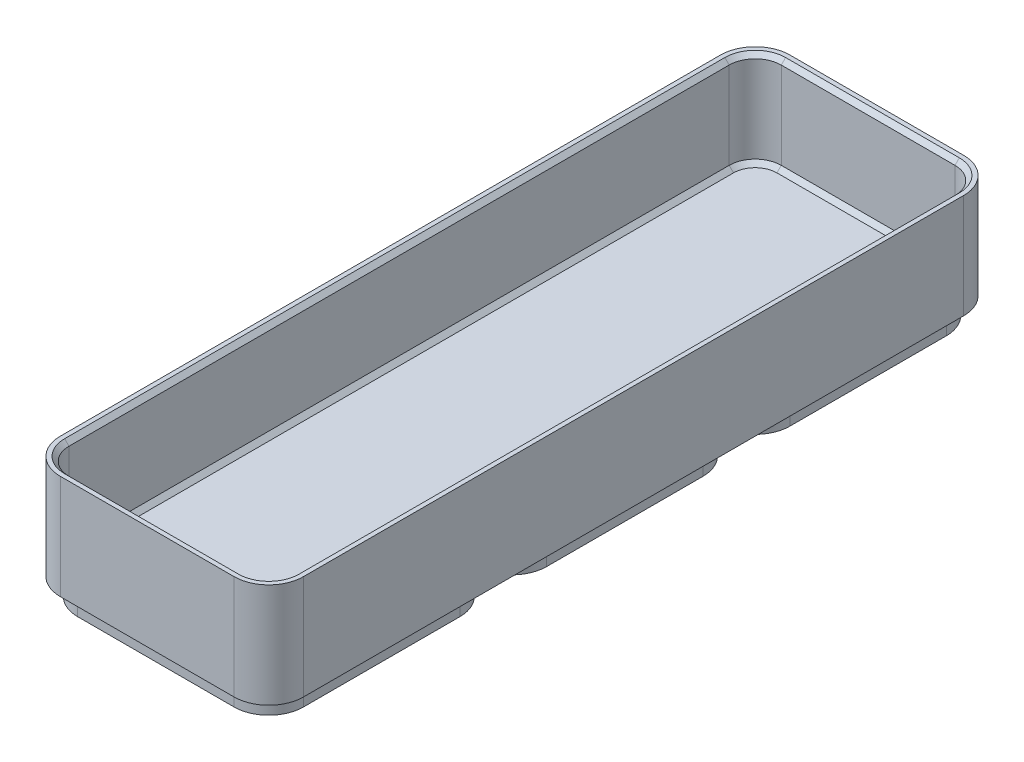
from build123d import *

# Parameters (mm, degrees)
BOSS_EXTRUDE4_DEPTH = 5
SKETCH7_R           = 3
CUT_EXTRUDE4_DEPTH  = 2
SKETCH8_W           = 70
SKETCH8_H           = 70
BOSS_EXTRUDE5_DEPTH = 30
MIRROR2_START       = 5
MIRROR2_OUTLINE_W   = 70
MIRROR2_OUTLINE_H   = 70
MIRROR2_DEPTH       = 30
MIRROR2_2_OUTLINE_R = 3
MIRROR2_2_DEPTH     = 5
MIRROR2_START_2     = 2
MIRROR2_3_OUTLINE_R = 3
MIRROR2_3_DEPTH     = 3
FILLET1_R           = 10
CUT_EXTRUDE5_DEPTH  = 30
BOSS_EXTRUDE6_DEPTH = 2.5
CHAMFER1_SIZE       = 1.25


# Read off the part's stored shape, not the designer's step: Mirror2
with BuildPart() as part:
    # Sketch5 → Boss-Extrude4 (new body)
    with BuildSketch(Plane(origin=(0, 0, 0), x_dir=(1, 0, 0), z_dir=(0, 1, 0))):
        with BuildLine():
            Line((-22.5, -32.5), (22.5, -32.5))
            ThreePointArc((22.5, -32.5), (29.571067812, -29.571067812), (32.5, -22.5))
            Line((32.5, -22.5), (32.5, 22.5))
            ThreePointArc((32.5, 22.5), (29.571067812, 29.571067812), (22.5, 32.5))
            Line((22.5, 32.5), (-22.5, 32.5))
            ThreePointArc((-22.5, 32.5), (-29.571067812, 29.571067812), (-32.5, 22.5))
            Line((-32.5, 22.5), (-32.5, -22.5))
            ThreePointArc((-32.5, -22.5), (-29.571067812, -29.571067812), (-22.5, -32.5))
        make_face()
    extrude(amount=BOSS_EXTRUDE4_DEPTH)

    # Sketch7 → Cut-Extrude4 (cut)
    with BuildSketch(Plane.XZ):
        with Locations(Location((-26.035533906, 26.035533906, 0), (0, 0, 270))):
            Circle(SKETCH7_R)
        with Locations(Location((26.036533906, 26.036533906, 0), (0, 0, 270))):
            Circle(SKETCH7_R)
        with Locations(Location((26.037533906, -26.035533906, 0), (0, 0, 270))):
            Circle(SKETCH7_R)
        with Locations(Location((-26.034533906, -26.036533906, 0), (0, 0, 270))):
            Circle(SKETCH7_R)
    extrude(amount=-CUT_EXTRUDE4_DEPTH, mode=Mode.SUBTRACT)

    # Sketch8 → Boss-Extrude5 (add)
    with BuildSketch(Plane(origin=(0, 5, 0), x_dir=(1, 0, 0), z_dir=(0, 1, 0))):
        Rectangle(SKETCH8_W, SKETCH8_H)
    extrude(amount=BOSS_EXTRUDE5_DEPTH)

    # Mirror2 outline → Mirror2 (add)
    with BuildSketch(Plane(origin=(0, 0, 0), x_dir=(1, 0, 0), z_dir=(0, 1, 0)).offset(MIRROR2_START)):
        with Locations((0, -70)):
            Rectangle(MIRROR2_OUTLINE_W, MIRROR2_OUTLINE_H)
        with Locations((0, 70)):
            Rectangle(MIRROR2_OUTLINE_W, MIRROR2_OUTLINE_H)
    extrude(amount=MIRROR2_DEPTH)

    # Mirror2 2 outline → Mirror2 2 (add)
    # profile 1 of 2: a face of its own
    with BuildSketch(Plane(origin=(0, 0, 0), x_dir=(1, 0, 0), z_dir=(0, 1, 0))):
        with BuildLine():
            Line((32.5, -92.5), (32.5, -47.5))
            ThreePointArc((32.5, -47.5), (29.571067812, -40.428932188), (22.5, -37.5))
            Line((22.5, -37.5), (-22.5, -37.5))
            ThreePointArc((-22.5, -37.5), (-29.571067812, -40.428932188), (-32.5, -47.5))
            Line((-32.5, -47.5), (-32.5, -92.5))
            ThreePointArc((-32.5, -92.5), (-29.571067812, -99.571067812), (-22.5, -102.5))
            Line((-22.5, -102.5), (22.5, -102.5))
            ThreePointArc((22.5, -102.5), (29.571067812, -99.571067812), (32.5, -92.5))
        make_face()
        with Locations((-26.034533906, -96.036533906)):
            Circle(MIRROR2_2_OUTLINE_R, mode=Mode.SUBTRACT)
        with Locations((-26.035533906, -43.964466094)):
            Circle(MIRROR2_2_OUTLINE_R, mode=Mode.SUBTRACT)
        with Locations((26.037533906, -96.035533906)):
            Circle(MIRROR2_2_OUTLINE_R, mode=Mode.SUBTRACT)
        with Locations((26.036533906, -43.963466094)):
            Circle(MIRROR2_2_OUTLINE_R, mode=Mode.SUBTRACT)
    # profile 2 of 2: a face of its own
    with BuildSketch(Plane(origin=(0, 0, 0), x_dir=(1, 0, 0), z_dir=(0, 1, 0))):
        with BuildLine():
            Line((32.5, 47.5), (32.5, 92.5))
            ThreePointArc((32.5, 92.5), (29.571067812, 99.571067812), (22.5, 102.5))
            Line((22.5, 102.5), (-22.5, 102.5))
            ThreePointArc((-22.5, 102.5), (-29.571067812, 99.571067812), (-32.5, 92.5))
            Line((-32.5, 92.5), (-32.5, 47.5))
            ThreePointArc((-32.5, 47.5), (-29.571067812, 40.428932188), (-22.5, 37.5))
            Line((-22.5, 37.5), (22.5, 37.5))
            ThreePointArc((22.5, 37.5), (29.571067812, 40.428932188), (32.5, 47.5))
        make_face()
        with Locations((-26.034533906, 43.963466094)):
            Circle(MIRROR2_2_OUTLINE_R, mode=Mode.SUBTRACT)
        with Locations((-26.035533906, 96.035533906)):
            Circle(MIRROR2_2_OUTLINE_R, mode=Mode.SUBTRACT)
        with Locations((26.037533906, 43.964466094)):
            Circle(MIRROR2_2_OUTLINE_R, mode=Mode.SUBTRACT)
        with Locations((26.036533906, 96.036533906)):
            Circle(MIRROR2_2_OUTLINE_R, mode=Mode.SUBTRACT)
    extrude(amount=MIRROR2_2_DEPTH)

    # Mirror2 3 outline → Mirror2 3 (add)
    with BuildSketch(Plane(origin=(0, 0, 0), x_dir=(1, 0, 0), z_dir=(0, 1, 0)).offset(MIRROR2_START_2)):
        with Locations((-26.035533906, -43.964466094)):
            Circle(MIRROR2_3_OUTLINE_R)
        with Locations((26.036533906, -43.963466094)):
            Circle(MIRROR2_3_OUTLINE_R)
        with Locations((26.037533906, -96.035533906)):
            Circle(MIRROR2_3_OUTLINE_R)
        with Locations((-26.034533906, -96.036533906)):
            Circle(MIRROR2_3_OUTLINE_R)
        with Locations((-26.035533906, 96.035533906)):
            Circle(MIRROR2_3_OUTLINE_R)
        with Locations((26.036533906, 96.036533906)):
            Circle(MIRROR2_3_OUTLINE_R)
        with Locations((26.037533906, 43.964466094)):
            Circle(MIRROR2_3_OUTLINE_R)
        with Locations((-26.034533906, 43.963466094)):
            Circle(MIRROR2_3_OUTLINE_R)
    extrude(amount=MIRROR2_3_DEPTH)

    # Fillet1
    fillet1_edges = [part.edges().sort_by_distance(p)[0] for p in [
        (35, 20, 105),
        (-35, 20, 105),
        (-35, 20, -105),
        (35, 20, -105),
    ]]
    fillet(fillet1_edges, radius=FILLET1_R)

    # Sketch9 → Cut-Extrude5 (cut)
    with BuildSketch(Plane(origin=(0, 35, 0), x_dir=(1, 0, 0), z_dir=(0, 1, 0))):
        with BuildLine():
            Line((-32.5, 95), (-32.5, -95))
            ThreePointArc((-32.5, -95), (-30.303300859, -100.303300859), (-25, -102.5))
            Line((-25, -102.5), (25, -102.5))
            ThreePointArc((25, -102.5), (30.303300859, -100.303300859), (32.5, -95))
            Line((32.5, -95), (32.5, 95))
            ThreePointArc((32.5, 95), (30.303300859, 100.303300859), (25, 102.5))
            Line((25, 102.5), (-25, 102.5))
            ThreePointArc((-25, 102.5), (-30.303300859, 100.303300859), (-32.5, 95))
        make_face()
    extrude(amount=-CUT_EXTRUDE5_DEPTH, mode=Mode.SUBTRACT)


with BuildPart() as cut_extrude5_piece_1:
    # of the separate pieces the step leaves, piece 1, a body of its own (cut_extrude5_pieces)
    add(part.part.solids().sort_by_distance((35, 5, 95))[0])



with BuildPart() as cut_extrude5_piece_2:
    # of the separate pieces the step leaves, piece 2, a body of its own (cut_extrude5_pieces)
    add(part.part.solids().sort_by_distance((32.5, 0, 92.5))[0])


with BuildPart() as cut_extrude5_piece_3:
    # of the separate pieces the step leaves, piece 3, a body of its own (cut_extrude5_pieces)
    add(part.part.solids().sort_by_distance((32.5, 0, -47.5))[0])


with BuildPart() as cut_extrude5_piece_4:
    # of the separate pieces the step leaves, piece 4, a body of its own (cut_extrude5_pieces)
    add(part.part.solids().sort_by_distance((32.5, 0, 22.5))[0])


with BuildPart() as cut_extrude5_piece_1_1:
    add(cut_extrude5_piece_1.part)

    add(cut_extrude5_piece_2.part)  # Boss-Extrude6 merges Cut-Extrude5 piece 2

    add(cut_extrude5_piece_3.part)  # Boss-Extrude6 merges Cut-Extrude5 piece 3

    add(cut_extrude5_piece_4.part)  # Boss-Extrude6 merges Cut-Extrude5 piece 4
    # Sketch10 → Boss-Extrude6 (add)
    with BuildSketch(Plane.XZ.offset(-5)):
        with BuildLine():
            Line((25, 105), (-25, 105))
            ThreePointArc((-25, 105), (-32.071067812, 102.071067812), (-35, 95))
            Line((-35, 95), (-35, -95))
            ThreePointArc((-35, -95), (-32.071067812, -102.071067812), (-25, -105))
            Line((-25, -105), (25, -105))
            ThreePointArc((25, -105), (32.071067812, -102.071067812), (35, -95))
            Line((35, -95), (35, 95))
            ThreePointArc((35, 95), (32.071067812, 102.071067812), (25, 105))
        make_face()
    extrude(amount=-BOSS_EXTRUDE6_DEPTH)

    # Chamfer1
    chamfer1_edges = [cut_extrude5_piece_1_1.edges().sort_by_distance(p)[0] for p in [
        (0, 35, 102.5),
        (-32.5, 35, 0),
        (-30.303300859, 35, 100.303300859),
        (30.303300859, 35, 100.303300859),
        (30.303300859, 35, -100.303300859),
        (-30.303300859, 35, -100.303300859),
        (-30.303300859, 7.5, -100.303300859),
        (0, 7.5, 102.5),
        (30.303300859, 7.5, 100.303300859),
        (32.5, 7.5, 0),
        (30.303300859, 7.5, -100.303300859),
        (0, 7.5, -102.5),
        (-32.5, 7.5, 0),
        (-30.303300859, 7.5, 100.303300859),
        (0, 35, -102.5),
        (32.5, 35, 0),
    ]]
    chamfer(chamfer1_edges, length=CHAMFER1_SIZE)


solid = cut_extrude5_piece_1_1.part
